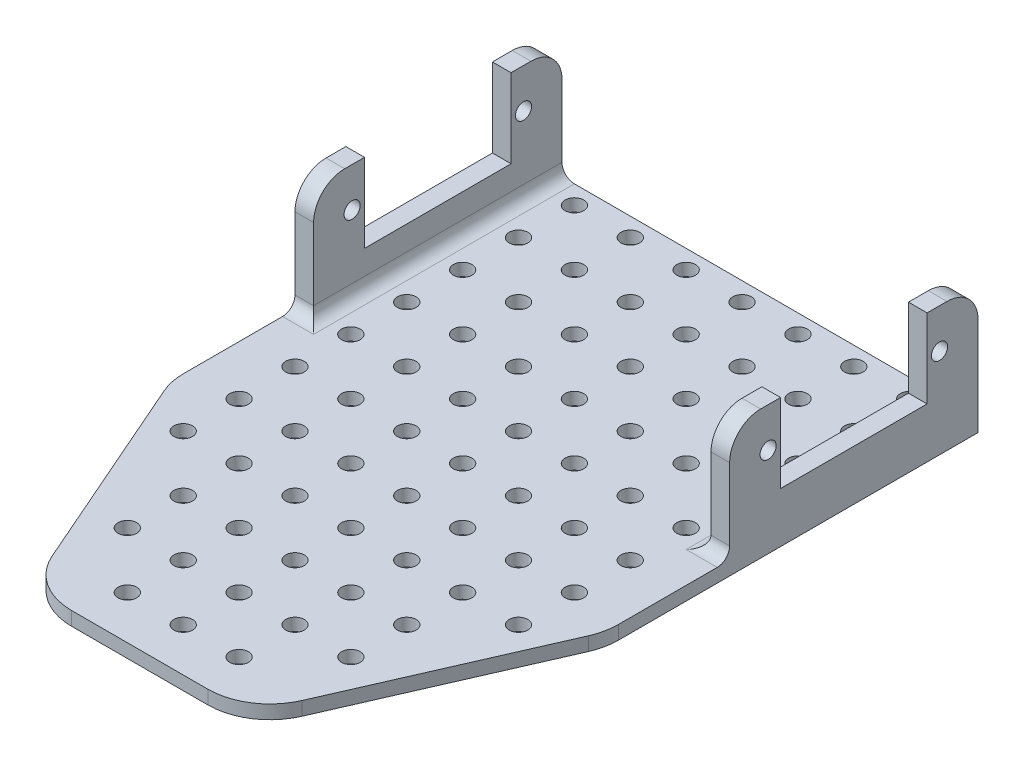
from build123d import *

# Parameters (mm, degrees)
BASE_DEPTH              = 2
SKETCH2_W               = 3
SKETCH2_H               = 40
SERVOLEG_DEPTH          = 18.6
SKETCH3_R               = 1.3
SERVOCUTOUT_DEPTH       = 80.942955098
FILLET2_R               = 10
FILLET3_R               = 2
FILLET4_R               = 5
SKETCH4_R               = 1.5
MATERIALREMOVAL_DEPTH   = 102.88839318
MOUNTINGHOLES_OUTLINE_R = 1.5
MOUNTINGHOLES_DEPTH     = 2
FIXTOPRINT3D_DEPTH      = 0.2


# Read off the part's stored shape, not the designer's step: MountingHoles
with BuildPart() as part:
    # Sketch1 → Base (new body)
    with BuildSketch(Plane(origin=(0, 0, 0), x_dir=(1, 0, 0), z_dir=(0, 1, 0))):
        Polygon((18.863636364, -70.303030303), (1.363636364, -30.303030303), (1.363636364, 29.696969697), (36.363636364, 29.696969697), (36.363636364, -70.303030303), align=None)
    extrude(amount=BASE_DEPTH)

    # Sketch2 → ServoLeg (add)
    with BuildSketch(Plane(origin=(0, 2, 0), x_dir=(1, 0, 0), z_dir=(0, 1, 0))):
        with Locations((2.863636364, 9.696969697)):
            Rectangle(SKETCH2_W, SKETCH2_H)
    extrude(amount=SERVOLEG_DEPTH)

    # Sketch3 → ServoCutout (cut, through all)
    with BuildSketch(Plane(origin=(4.363636364, 0, 0), x_dir=(0, 0, -1), z_dir=(1, 0, 0))):
        with Locations((23.496969697, 14.25)):
            Circle(SKETCH3_R)
        with Locations((-4.103030303, 14.25)):
            Circle(SKETCH3_R)
        Polygon((21.496969697, 20.6), (-2.103030303, 20.6), (-2.103030303, 15.55), (-2.103030303, 12.95), (-2.103030303, 7.9), (21.496969697, 7.9), (21.496969697, 12.95), (21.496969697, 15.55), align=None)
    extrude(amount=-SERVOCUTOUT_DEPTH, mode=Mode.SUBTRACT)

    # Fillet2
    fillet2_edges = [part.edges().sort_by_distance(p)[0] for p in [
        (18.863636364, 1, 70.303030303),
        (1.363636364, 1, 30.303030303),
    ]]
    fillet(fillet2_edges, radius=FILLET2_R)

    # Fillet3
    fillet3_edges = [part.edges().sort_by_distance(p)[0] for p in [
        (2.863636364, 2, 10.303030303),
        (4.363636364, 2, -9.696969697),
    ]]
    fillet(fillet3_edges, radius=FILLET3_R)

    # Fillet4
    fillet4_edges = [part.edges().sort_by_distance(p)[0] for p in [
        (2.863636364, 20.6, 10.303030303),
        (2.863636364, 20.6, -29.696969697),
    ]]
    fillet(fillet4_edges, radius=FILLET4_R)

    # Mirror1: part across plane


with BuildPart() as part_1:
    add(part.part)
    add(part.part.mirror(Plane(origin=(36.363636364, 2, -29.696969697), x_dir=(0, 0, 1), z_dir=(-1, 0, 0))))

    # Sketch4 → MaterialRemoval (cut, through all)
    with BuildSketch(Plane(origin=(0, 2, 0), x_dir=(1, 0, 0), z_dir=(0, 1, 0))):
        with Locations(Location((9.363636364, 26.696969697, 0), (0, 0, 270))):
            Circle(SKETCH4_R)
    extrude(amount=-MATERIALREMOVAL_DEPTH, mode=Mode.SUBTRACT)

    # MountingHoles outline → MountingHoles (cut)
    with BuildSketch(Plane(origin=(0, 0, 0), x_dir=(1, 0, 0), z_dir=(0, 1, 0))):
        with Locations((9.363636364, -36.303030303)):
            Circle(MOUNTINGHOLES_OUTLINE_R)
        with Locations((63.363636364, 26.696969697)):
            Circle(MOUNTINGHOLES_OUTLINE_R)
        with Locations((63.363636364, 17.696969697)):
            Circle(MOUNTINGHOLES_OUTLINE_R)
        with Locations((63.363636364, 8.696969697)):
            Circle(MOUNTINGHOLES_OUTLINE_R)
        with Locations((18.363636364, 26.696969697)):
            Circle(MOUNTINGHOLES_OUTLINE_R)
        with Locations((18.363636364, 17.696969697)):
            Circle(MOUNTINGHOLES_OUTLINE_R)
        with Locations((18.363636364, 8.696969697)):
            Circle(MOUNTINGHOLES_OUTLINE_R)
        with Locations((18.363636364, -0.303030303)):
            Circle(MOUNTINGHOLES_OUTLINE_R)
        with Locations((18.363636364, -9.303030303)):
            Circle(MOUNTINGHOLES_OUTLINE_R)
        with Locations((18.363636364, -18.303030303)):
            Circle(MOUNTINGHOLES_OUTLINE_R)
        with Locations((18.363636364, -27.303030303)):
            Circle(MOUNTINGHOLES_OUTLINE_R)
        with Locations((18.363636364, -36.303030303)):
            Circle(MOUNTINGHOLES_OUTLINE_R)
        with Locations((9.363636364, -27.303030303)):
            Circle(MOUNTINGHOLES_OUTLINE_R)
        with Locations((9.363636364, -18.303030303)):
            Circle(MOUNTINGHOLES_OUTLINE_R)
        with Locations((9.363636364, -9.303030303)):
            Circle(MOUNTINGHOLES_OUTLINE_R)
        with Locations((9.363636364, -0.303030303)):
            Circle(MOUNTINGHOLES_OUTLINE_R)
        with Locations((9.363636364, 8.696969697)):
            Circle(MOUNTINGHOLES_OUTLINE_R)
        with Locations((9.363636364, 17.696969697)):
            Circle(MOUNTINGHOLES_OUTLINE_R)
        with Locations((18.363636364, -54.303030303)):
            Circle(MOUNTINGHOLES_OUTLINE_R)
        with Locations((18.363636364, -45.303030303)):
            Circle(MOUNTINGHOLES_OUTLINE_R)
        with Locations((36.363636364, -63.303030303)):
            Circle(MOUNTINGHOLES_OUTLINE_R)
        with Locations((27.363636364, 26.696969697)):
            Circle(MOUNTINGHOLES_OUTLINE_R)
        with Locations((27.363636364, 17.696969697)):
            Circle(MOUNTINGHOLES_OUTLINE_R)
        with Locations((27.363636364, 8.696969697)):
            Circle(MOUNTINGHOLES_OUTLINE_R)
        with Locations((36.363636364, -54.303030303)):
            Circle(MOUNTINGHOLES_OUTLINE_R)
        with Locations((36.363636364, -45.303030303)):
            Circle(MOUNTINGHOLES_OUTLINE_R)
        with Locations((36.363636364, -36.303030303)):
            Circle(MOUNTINGHOLES_OUTLINE_R)
        with Locations((36.363636364, -27.303030303)):
            Circle(MOUNTINGHOLES_OUTLINE_R)
        with Locations((27.363636364, -0.303030303)):
            Circle(MOUNTINGHOLES_OUTLINE_R)
        with Locations((27.363636364, -9.303030303)):
            Circle(MOUNTINGHOLES_OUTLINE_R)
        with Locations((27.363636364, -18.303030303)):
            Circle(MOUNTINGHOLES_OUTLINE_R)
        with Locations((27.363636364, -27.303030303)):
            Circle(MOUNTINGHOLES_OUTLINE_R)
        with Locations((27.363636364, -36.303030303)):
            Circle(MOUNTINGHOLES_OUTLINE_R)
        with Locations((27.363636364, -45.303030303)):
            Circle(MOUNTINGHOLES_OUTLINE_R)
        with Locations((27.363636364, -54.303030303)):
            Circle(MOUNTINGHOLES_OUTLINE_R)
        with Locations((27.363636364, -63.303030303)):
            Circle(MOUNTINGHOLES_OUTLINE_R)
        with Locations((54.363636364, -0.303030303)):
            Circle(MOUNTINGHOLES_OUTLINE_R)
        with Locations((54.363636364, -9.303030303)):
            Circle(MOUNTINGHOLES_OUTLINE_R)
        with Locations((54.363636364, -18.303030303)):
            Circle(MOUNTINGHOLES_OUTLINE_R)
        with Locations((54.363636364, -27.303030303)):
            Circle(MOUNTINGHOLES_OUTLINE_R)
        with Locations((45.363636364, 26.696969697)):
            Circle(MOUNTINGHOLES_OUTLINE_R)
        with Locations((54.363636364, -54.303030303)):
            Circle(MOUNTINGHOLES_OUTLINE_R)
        with Locations((54.363636364, -45.303030303)):
            Circle(MOUNTINGHOLES_OUTLINE_R)
        with Locations((54.363636364, -36.303030303)):
            Circle(MOUNTINGHOLES_OUTLINE_R)
        with Locations((63.363636364, -0.303030303)):
            Circle(MOUNTINGHOLES_OUTLINE_R)
        with Locations((63.363636364, -9.303030303)):
            Circle(MOUNTINGHOLES_OUTLINE_R)
        with Locations((63.363636364, -18.303030303)):
            Circle(MOUNTINGHOLES_OUTLINE_R)
        with Locations((63.363636364, -27.303030303)):
            Circle(MOUNTINGHOLES_OUTLINE_R)
        with Locations((54.363636364, 8.696969697)):
            Circle(MOUNTINGHOLES_OUTLINE_R)
        with Locations((54.363636364, 17.696969697)):
            Circle(MOUNTINGHOLES_OUTLINE_R)
        with Locations((54.363636364, 26.696969697)):
            Circle(MOUNTINGHOLES_OUTLINE_R)
        with Locations((63.363636364, -36.303030303)):
            Circle(MOUNTINGHOLES_OUTLINE_R)
        with Locations((45.363636364, -54.303030303)):
            Circle(MOUNTINGHOLES_OUTLINE_R)
        with Locations((45.363636364, -63.303030303)):
            Circle(MOUNTINGHOLES_OUTLINE_R)
        with Locations((36.363636364, 26.696969697)):
            Circle(MOUNTINGHOLES_OUTLINE_R)
        with Locations((36.363636364, 17.696969697)):
            Circle(MOUNTINGHOLES_OUTLINE_R)
        with Locations((36.363636364, 8.696969697)):
            Circle(MOUNTINGHOLES_OUTLINE_R)
        with Locations((36.363636364, -0.303030303)):
            Circle(MOUNTINGHOLES_OUTLINE_R)
        with Locations((36.363636364, -9.303030303)):
            Circle(MOUNTINGHOLES_OUTLINE_R)
        with Locations((36.363636364, -18.303030303)):
            Circle(MOUNTINGHOLES_OUTLINE_R)
        with Locations((45.363636364, -45.303030303)):
            Circle(MOUNTINGHOLES_OUTLINE_R)
        with Locations((45.363636364, -36.303030303)):
            Circle(MOUNTINGHOLES_OUTLINE_R)
        with Locations((45.363636364, -27.303030303)):
            Circle(MOUNTINGHOLES_OUTLINE_R)
        with Locations((45.363636364, -18.303030303)):
            Circle(MOUNTINGHOLES_OUTLINE_R)
        with Locations((45.363636364, -9.303030303)):
            Circle(MOUNTINGHOLES_OUTLINE_R)
        with Locations((45.363636364, -0.303030303)):
            Circle(MOUNTINGHOLES_OUTLINE_R)
        with Locations((45.363636364, 8.696969697)):
            Circle(MOUNTINGHOLES_OUTLINE_R)
        with Locations((45.363636364, 17.696969697)):
            Circle(MOUNTINGHOLES_OUTLINE_R)
    extrude(amount=MOUNTINGHOLES_DEPTH, mode=Mode.SUBTRACT)

    # Sketch5 → FixToPrint3d (add)
    with BuildSketch(Plane.XZ):
        with BuildLine():
            Line((47.323480616, 70.303030303), (25.403792111, 70.303030303))
            ThreePointArc((25.403792111, 70.303030303), (19.930305261, 68.672076945), (16.242218762, 64.311218643))
            Line((16.242218762, 64.311218643), (2.202063015, 32.219434077))
            ThreePointArc((2.202063015, 32.219434077), (1.575487062, 30.258715701), (1.363636364, 28.211245736))
            Line((1.363636364, 28.211245736), (1.363636364, -29.696969697))
            Line((1.363636364, -29.696969697), (71.363636364, -29.696969697))
            Line((71.363636364, -29.696969697), (71.363636364, 28.211245736))
            ThreePointArc((71.363636364, 28.211245736), (71.151785665, 30.258715701), (70.525209713, 32.219434077))
            Line((70.525209713, 32.219434077), (56.485053965, 64.311218643))
            ThreePointArc((56.485053965, 64.311218643), (52.796967466, 68.672076945), (47.323480616, 70.303030303))
        make_face()
    extrude(amount=FIXTOPRINT3D_DEPTH)


solid = part_1.part
